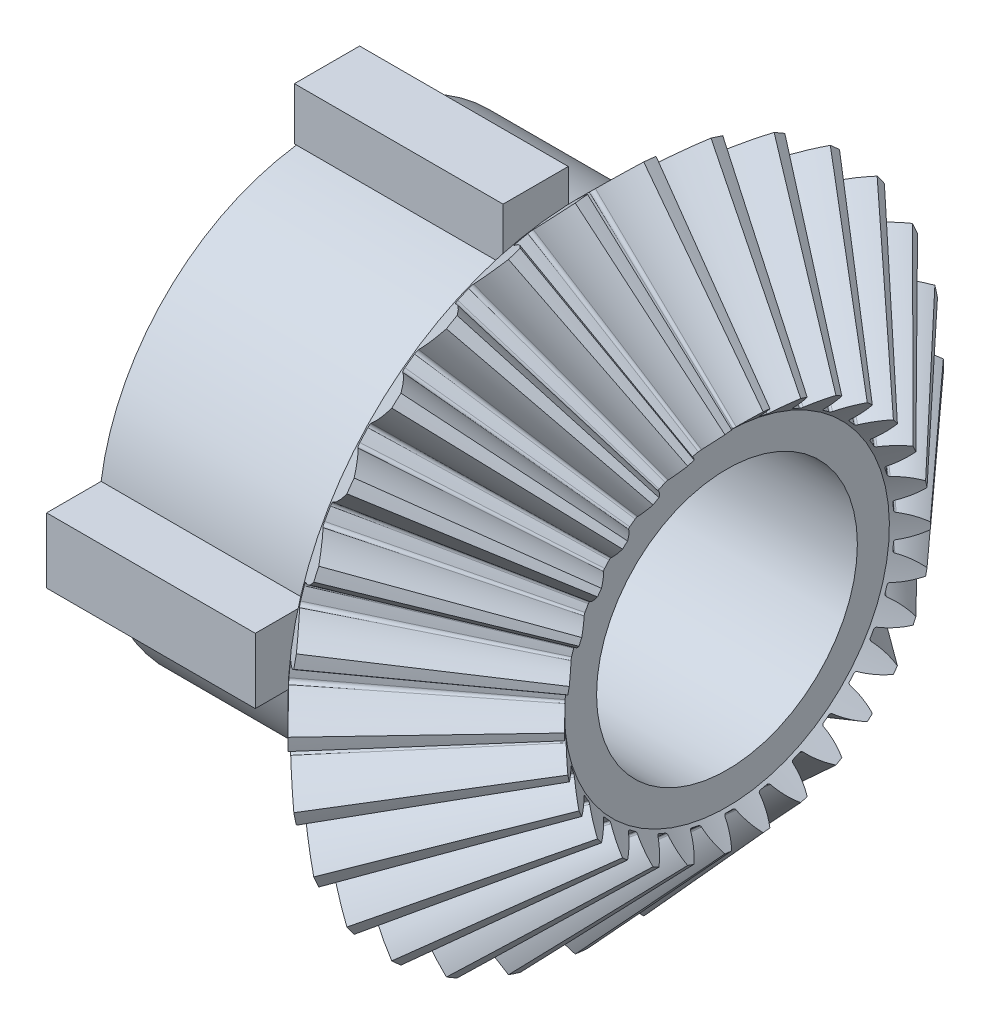
from build123d import *

# Parameters (mm, degrees)
TEETHCUTS_COUNT     = 30
TEETHCUTS_ANGLE     = 348
HUBSKE_R            = 8.75
HUB_DEPTH           = 9.65917486
BORSKE_R            = 5
BORE_DEPTH          = 22.5000508
SKETCH3_W           = 2.5
SKETCH3_H           = 2
SKETCH3_H_2         = 2.089745962
SKETCH3_W_2         = 2
SKETCH3_H_3         = 2.5
SKETCH3_W_3         = 2.089745962
BOSS_EXTRUDE2_DEPTH = 8


with BuildPart() as part:
    # BasProSke → Base-Revolve (revolve)
    with BuildSketch(Plane(origin=(0, 0, 0), x_dir=(1, 0, 0), z_dir=(0, 1, 0)), mode=Mode.PRIVATE) as base_revolve_sk:
        Polygon((0, 0), (0, 11.159073261), (1.406612166, 12.565685424), (6.459913019, 7.012384561), (5.67494148, 6.227413023), (5.67494148, 0), align=None)
    revolve(base_revolve_sk.sketch.rotate(Axis((-10, 0, 0), (1, 0, 0)), 180), axis=Axis((-10, 0, 0), (1, 0, 0)))

    # ToothCut: read off the stored shape, not the designer's step
    # ToothCut: loft between two sections, ruled curve by curve
    toothcut_from = [
        Edge.make_bspline([(12.847300231, 0.006373491, -0.008946896), (12.842944603, 0.002017862, -0.015152536), (12.836793561, -0.004133179, -0.014268034), (12.833410296, -0.007516444, -0.006949565)], [0, 0, 0, 0, 1, 1, 1, 1], 3, [1, 0.752714571, 0.752714571, 1]),
        Edge.make_bspline([(12.833410296, -0.007516444, 0.006949565), (12.836793561, -0.004133179, 0.014268034), (12.842944603, 0.002017862, 0.015152536), (12.847300231, 0.006373491, 0.008946896)], [0, 0, 0, 0, 1, 1, 1, 1], 3, [1, 0.752714571, 0.752714571, 1]),
        Edge.make_bspline([(12.833410296, -0.007516444, -0.006949565), (12.832979803, -0.007946937, -0.00601835), (12.832639033, -0.008287707, -0.005015575), (12.832393827, -0.008532913, -0.003958429)], [0, 0, 0, 0, 1, 1, 1, 1], 3, [1, 0.994285284, 0.994285284, 1]),
        Edge.make_bspline([(12.832393827, -0.008532913, 0.003958429), (12.832639033, -0.008287707, 0.005015575), (12.832979803, -0.007946937, 0.00601835), (12.833410296, -0.007516444, 0.006949565)], [0, 0, 0, 0, 1, 1, 1, 1], 3, [1, 0.994285284, 0.994285284, 1]),
        Edge.make_bspline([(12.832393827, -0.008532913, -0.003958429), (12.831792233, -0.009134507, -0.001364802), (12.831792233, -0.009134507, 0.001364802), (12.832393827, -0.008532913, 0.003958429)], [0, 0, 0, 0, 1, 1, 1, 1], 3, [1, 0.966789815, 0.966789815, 1]),
        Edge.make_line((12.847300231, 0.006373491, 0.008946896), (12.847300231, 0.006373491, -0.008946896)),
    ]
    toothcut_to = [
        Edge.make_bspline([(1.545657618, 12.704730877, -1.243577752), (1.160511909, 12.319585168, -0.826758059), (0.721824165, 11.880897425, -0.534321367), (0.249368946, 11.408442207, -0.379449733)], [0, 0, 0, 0, 1, 1, 1, 1], 3, [1, 0.984974462, 0.984974462, 1]),
        Edge.make_bspline([(0.249368946, 11.408442207, 0.379449733), (0.721824165, 11.880897425, 0.534321367), (1.160511909, 12.319585168, 0.826758059), (1.545657618, 12.704730877, 1.243577752)], [0, 0, 0, 0, 1, 1, 1, 1], 3, [1, 0.984974462, 0.984974462, 1]),
        Edge.make_bspline([(0.249368946, 11.408442207, -0.379449733), (0.197873168, 11.356946428, -0.362569328), (0.165414848, 11.324488109, -0.303565147), (0.166509638, 11.325582899, -0.228824386)], [0, 0, 0, 0, 1, 1, 1, 1], 3, [1, 0.850930354, 0.850930354, 1]),
        Edge.make_bspline([(0.166509638, 11.325582899, 0.228824386), (0.165414848, 11.324488109, 0.303565147), (0.197873168, 11.356946428, 0.362569328), (0.249368946, 11.408442207, 0.379449733)], [0, 0, 0, 0, 1, 1, 1, 1], 3, [1, 0.850930354, 0.850930354, 1]),
        Edge.make_bspline([(0.166509638, 11.325582899, -0.228824386), (0.168743998, 11.327817259, -0.076285704), (0.168743998, 11.327817259, 0.076285704), (0.166509638, 11.325582899, 0.228824386)], [0, 0, 0, 0, 1, 1, 1, 1], 3, [1, 0.999857007, 0.999857007, 1]),
        Edge.make_line((1.545657618, 12.704730877, 1.243577752), (1.545657618, 12.704730877, -1.243577752)),
    ]
    toothcut = Solid(Shell([*[Face.make_surface_from_curves(toothcut_from[k], toothcut_to[k]) for k in range(6)], Face(Wire(toothcut_from)), Face(Wire(toothcut_to))]))
    add(toothcut, mode=Mode.SUBTRACT)

    # TeethCuts: ToothCut ×30 about axis
    teethcuts_axis = Axis((-10, 0, 0), (1, 0, 0))
    for i in range(1, TEETHCUTS_COUNT):
        add(toothcut.rotate(teethcuts_axis, i * TEETHCUTS_ANGLE / (TEETHCUTS_COUNT - 1)), mode=Mode.SUBTRACT)

    # HubSke → Hub (add)
    with BuildSketch(Plane.ZY):
        with Locations(Location((0, 0, 0), (0, 0, 180))):
            Circle(HUBSKE_R)
    extrude(amount=HUB_DEPTH)

    # BorSke → Bore (cut, symmetric)
    with BuildSketch(Plane(origin=(0, 0, 0), x_dir=(0, 0, -1), z_dir=(1, 0, 0))):
        with Locations(Location((0, 0, 0), (0, 0, 180))):
            Circle(BORSKE_R)
    extrude(amount=BORE_DEPTH, both=True, mode=Mode.SUBTRACT)

    # Sketch3 → Boss-Extrude2 (add)
    with BuildSketch(Plane.ZY.offset(9.65917486)):
        with Locations((0, 9.75)):
            Rectangle(SKETCH3_W, SKETCH3_H)
        with Locations((0, -9.705127019)):
            Rectangle(SKETCH3_W, SKETCH3_H_2)
        with Locations((-9.75, 0)):
            Rectangle(SKETCH3_W_2, SKETCH3_H_3)
        with Locations((9.705127019, 0)):
            Rectangle(SKETCH3_W_3, SKETCH3_H_3)
    extrude(amount=-BOSS_EXTRUDE2_DEPTH)


with BuildPart() as boss_extrude2_piece_1:
    # of the separate pieces the step leaves, piece 1, a body of its own (boss_extrude2_pieces)
    add(part.part.solids().sort_by_distance((0, 0, 11.159073261))[0])


with BuildPart() as boss_extrude2_piece_2:
    # of the separate pieces the step leaves, piece 2, a body of its own (boss_extrude2_pieces)
    add(part.part.solids().sort_by_distance((-9.65917486, 1.25, -8.75))[0])


with BuildPart() as boss_extrude2_piece_3:
    # of the separate pieces the step leaves, piece 3, a body of its own (boss_extrude2_pieces)
    add(part.part.solids().sort_by_distance((-9.65917486, 8.75, -1.25))[0])


solid = Compound([boss_extrude2_piece_1.part, boss_extrude2_piece_2.part, boss_extrude2_piece_3.part])
